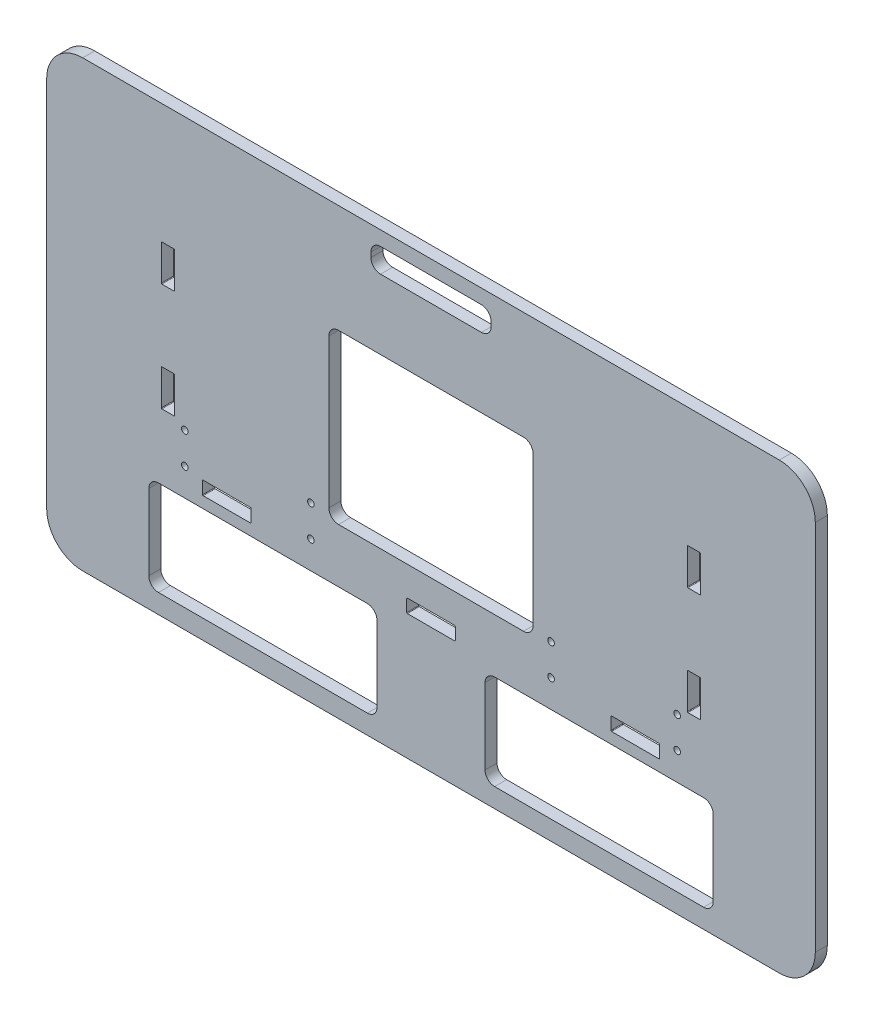
from build123d import *

# Parameters (mm, degrees)
SKETCH_1_W                  = 640
SKETCH_1_H                  = 370
EXTRUDE_1618_DEPTH          = 5
SKETCH_2_W                  = 190
SKETCH_2_H                  = 79
CUT_EXTRUDE_1669_DEPTH      = 383.785840908
FILLET_R_R                  = 8
FILLET_R_OF_MIRROR_1948_R   = 8
CUT_EXTRUDE_1976_DEPTH      = 383.785840908
CUT_EXTRUDE_1976_DEPTH_BACK = 383.785840908
SKETCH_3_W                  = 170
SKETCH_3_H                  = 140
FILLET_R_2_R                = 8
SKETCH_4_W                  = 11.2
SKETCH_4_H                  = 30.4
CUT_EXTRUDE_2232_DEPTH      = 383.785840908
FILLET_R_3_R                = 0.5
FILLET_R_3_OF_MIRROR_2515_R = 0.5
MIRROR_START                = -5
MIRROR_2537_DEPTH           = 10
CUT_EXTRUDE_2565_DEPTH      = 383.785840908
CUT_EXTRUDE_2565_DEPTH_BACK = 383.785840908
SKETCH_5_W                  = 40.4
SKETCH_5_H                  = 11.2
FILLET_R_4_R                = 0.5
SKETCH_6_W                  = 40.4
SKETCH_6_H                  = 11.2
CUT_EXTRUDE_2821_DEPTH      = 383.785840908
FILLET_R_5_R                = 0.5
FILLET_R_5_OF_MIRROR_3088_R = 0.5
CUT_EXTRUDE_3116_DEPTH      = 383.785840908
CUT_EXTRUDE_3116_DEPTH_BACK = 383.785840908
SKETCH_7_W                  = 100
SKETCH_7_H                  = 20
FILLET_R_6_R                = 8
HOLE_WIZARD_3368_D          = 5.5
HOLE_WIZARD_3368_DEPTH      = 10
HOLE_WIZARD_3368_TIP        = 1.652366702
FILLET_R_7_R                = 30


# Read off the part's stored shape, not the designer's step: 角穴 筒受け・筒押え(後)
with BuildPart() as part:
    # ｽｹｯﾁ1 → Extrude 1618 (new, symmetric)
    with BuildSketch(Plane.XY):
        with Locations((0, -25)):
            Rectangle(SKETCH_1_W, SKETCH_1_H)
    extrude(amount=EXTRUDE_1618_DEPTH, both=True)

    # ｽｹｯﾁ2 → Cut-Extrude 1669 (cut, symmetric)
    with BuildSketch(Plane.XY):
        with Locations((140, -154.5)):
            Rectangle(SKETCH_2_W, SKETCH_2_H)
    cut_extrude_1669 = extrude(amount=CUT_EXTRUDE_1669_DEPTH, both=True, mode=Mode.SUBTRACT)

    # Fillet R
    fillet_r_edges = [part.edges().sort_by_distance(p)[0] for p in [
        (45, -194, 0),
        (45, -115, 0),
        (235, -115, 0),
        (235, -194, 0),
    ]]
    fillet(fillet_r_edges, radius=FILLET_R_R)

    # Mirror 1948: Cut-Extrude 1669 across plane
    add(cut_extrude_1669.mirror(Plane(origin=(0, 0, 0), x_dir=(0, 0, 1), z_dir=(1, 0, 0))), mode=Mode.SUBTRACT)

    # Fillet R of Mirror 1948
    fillet_r_of_mirror_1948_edges = [part.edges().sort_by_distance(p)[0] for p in [
        (-45, -194, 0),
        (-45, -115, 0),
        (-235, -115, 0),
        (-235, -194, 0),
    ]]
    fillet(fillet_r_of_mirror_1948_edges, radius=FILLET_R_OF_MIRROR_1948_R)

    # ｽｹｯﾁ3 → Cut-Extrude 1976 (cut, two sides: drawn at the far end of the back side and taken through both)
    with BuildSketch(Plane.XY.offset(-CUT_EXTRUDE_1976_DEPTH_BACK)):
        Rectangle(SKETCH_3_W, SKETCH_3_H)
    extrude(amount=CUT_EXTRUDE_1976_DEPTH + CUT_EXTRUDE_1976_DEPTH_BACK, mode=Mode.SUBTRACT)

    # Fillet R 2
    fillet_r_2_edges = [part.edges().sort_by_distance(p)[0] for p in [
        (-85, -70, 0),
        (-85, 70, 0),
        (85, 70, 0),
        (85, -70, 0),
    ]]
    fillet(fillet_r_2_edges, radius=FILLET_R_2_R)

    # ｽｹｯﾁ4 → Cut-Extrude 2232 (cut, symmetric)
    with BuildSketch(Plane.XY):
        with Locations((219, -45)):
            Rectangle(SKETCH_4_W, SKETCH_4_H)
    cut_extrude_2232 = extrude(amount=CUT_EXTRUDE_2232_DEPTH, both=True, mode=Mode.SUBTRACT)

    # Fillet R 3
    fillet_r_3_edges = [part.edges().sort_by_distance(p)[0] for p in [
        (213.4, -60.2, 0),
        (213.4, -29.8, 0),
        (224.6, -29.8, 0),
        (224.6, -60.2, 0),
    ]]
    fillet(fillet_r_3_edges, radius=FILLET_R_3_R)

    # Mirror 2515: Cut-Extrude 2232 across plane
    add(cut_extrude_2232.mirror(Plane.ZX), mode=Mode.SUBTRACT)

    # Fillet R 3 of Mirror 2515
    fillet_r_3_of_mirror_2515_edges = [part.edges().sort_by_distance(p)[0] for p in [
        (213.4, 60.2, 0),
        (213.4, 29.8, 0),
        (224.6, 29.8, 0),
        (224.6, 60.2, 0),
    ]]
    fillet(fillet_r_3_of_mirror_2515_edges, radius=FILLET_R_3_OF_MIRROR_2515_R)

    # Mirror 2537 outline → Mirror 2537 (cut)
    with BuildSketch(Plane.XY.offset(MIRROR_START)):
        with BuildLine():
            Line((-213.9, -29.8), (-224.1, -29.8))
            ThreePointArc((-224.1, -29.8), (-224.453553391, -29.946446609), (-224.6, -30.3))
            Line((-224.6, -30.3), (-224.6, -59.7))
            ThreePointArc((-224.6, -59.7), (-224.453553391, -60.053553391), (-224.1, -60.2))
            Line((-224.1, -60.2), (-213.9, -60.2))
            ThreePointArc((-213.9, -60.2), (-213.546446609, -60.053553391), (-213.4, -59.7))
            Line((-213.4, -59.7), (-213.4, -30.3))
            ThreePointArc((-213.4, -30.3), (-213.546446609, -29.946446609), (-213.9, -29.8))
        make_face()
        with BuildLine():
            ThreePointArc((-213.4, 59.7), (-213.546446609, 60.053553391), (-213.9, 60.2))
            Line((-213.9, 60.2), (-224.1, 60.2))
            ThreePointArc((-224.1, 60.2), (-224.453553391, 60.053553391), (-224.6, 59.7))
            Line((-224.6, 59.7), (-224.6, 30.3))
            ThreePointArc((-224.6, 30.3), (-224.453553391, 29.946446609), (-224.1, 29.8))
            Line((-224.1, 29.8), (-213.9, 29.8))
            ThreePointArc((-213.9, 29.8), (-213.546446609, 29.946446609), (-213.4, 30.3))
            Line((-213.4, 30.3), (-213.4, 59.7))
        make_face()
    extrude(amount=MIRROR_2537_DEPTH, mode=Mode.SUBTRACT)

    # ｽｹｯﾁ5 → Cut-Extrude 2565 (cut, two sides: drawn at the far end of the back side and taken through both)
    with BuildSketch(Plane.XY.offset(-CUT_EXTRUDE_2565_DEPTH_BACK)):
        with Locations((0, -100)):
            Rectangle(SKETCH_5_W, SKETCH_5_H)
    extrude(amount=CUT_EXTRUDE_2565_DEPTH + CUT_EXTRUDE_2565_DEPTH_BACK, mode=Mode.SUBTRACT)

    # Fillet R 4
    fillet_r_4_edges = [part.edges().sort_by_distance(p)[0] for p in [
        (-20.2, -105.6, 0),
        (-20.2, -94.4, 0),
        (20.2, -94.4, 0),
        (20.2, -105.6, 0),
    ]]
    fillet(fillet_r_4_edges, radius=FILLET_R_4_R)

    # ｽｹｯﾁ6 → Cut-Extrude 2821 (cut, symmetric)
    with BuildSketch(Plane.XY):
        with Locations((170, -100)):
            Rectangle(SKETCH_6_W, SKETCH_6_H)
    cut_extrude_2821 = extrude(amount=CUT_EXTRUDE_2821_DEPTH, both=True, mode=Mode.SUBTRACT)

    # Fillet R 5
    fillet_r_5_edges = [part.edges().sort_by_distance(p)[0] for p in [
        (149.8, -105.6, 0),
        (149.8, -94.4, 0),
        (190.2, -94.4, 0),
        (190.2, -105.6, 0),
    ]]
    fillet(fillet_r_5_edges, radius=FILLET_R_5_R)

    # Mirror 3088: Cut-Extrude 2821 across plane
    add(cut_extrude_2821.mirror(Plane(origin=(0, 0, 0), x_dir=(0, 0, 1), z_dir=(1, 0, 0))), mode=Mode.SUBTRACT)

    # Fillet R 5 of Mirror 3088
    fillet_r_5_of_mirror_3088_edges = [part.edges().sort_by_distance(p)[0] for p in [
        (-149.8, -105.6, 0),
        (-149.8, -94.4, 0),
        (-190.2, -94.4, 0),
        (-190.2, -105.6, 0),
    ]]
    fillet(fillet_r_5_of_mirror_3088_edges, radius=FILLET_R_5_OF_MIRROR_3088_R)

    # ｽｹｯﾁ7 → Cut-Extrude 3116 (cut, two sides: drawn at the far end of the back side and taken through both)
    with BuildSketch(Plane.XY.offset(-CUT_EXTRUDE_3116_DEPTH_BACK)):
        with Locations((0, 138)):
            Rectangle(SKETCH_7_W, SKETCH_7_H)
    extrude(amount=CUT_EXTRUDE_3116_DEPTH + CUT_EXTRUDE_3116_DEPTH_BACK, mode=Mode.SUBTRACT)

    # Fillet R 6
    fillet_r_6_edges = [part.edges().sort_by_distance(p)[0] for p in [
        (-50, 128, 0),
        (-50, 148, 0),
        (50, 148, 0),
        (50, 128, 0),
    ]]
    fillet(fillet_r_6_edges, radius=FILLET_R_6_R)

    # Hole Wizard 3368
    with Locations(Plane.XY.offset(5)):
        with Locations((100, -66), (100, -92), (-100, -66), (-100, -92), (205, -66), (205, -92), (-205, -66), (-205, -92)):
            Hole(HOLE_WIZARD_3368_D / 2, depth=HOLE_WIZARD_3368_DEPTH)
            with Locations((0, 0, -(HOLE_WIZARD_3368_DEPTH + HOLE_WIZARD_3368_TIP / 2))):  # 118° drill point
                Cone(0, HOLE_WIZARD_3368_D / 2, HOLE_WIZARD_3368_TIP, mode=Mode.SUBTRACT)

    # Fillet R 7
    fillet_r_7_edges = [part.edges().sort_by_distance(p)[0] for p in [
        (-320, 160, 0),
        (320, 160, 0),
        (320, -210, 0),
        (-320, -210, 0),
    ]]
    fillet(fillet_r_7_edges, radius=FILLET_R_7_R)


solid = part.part
